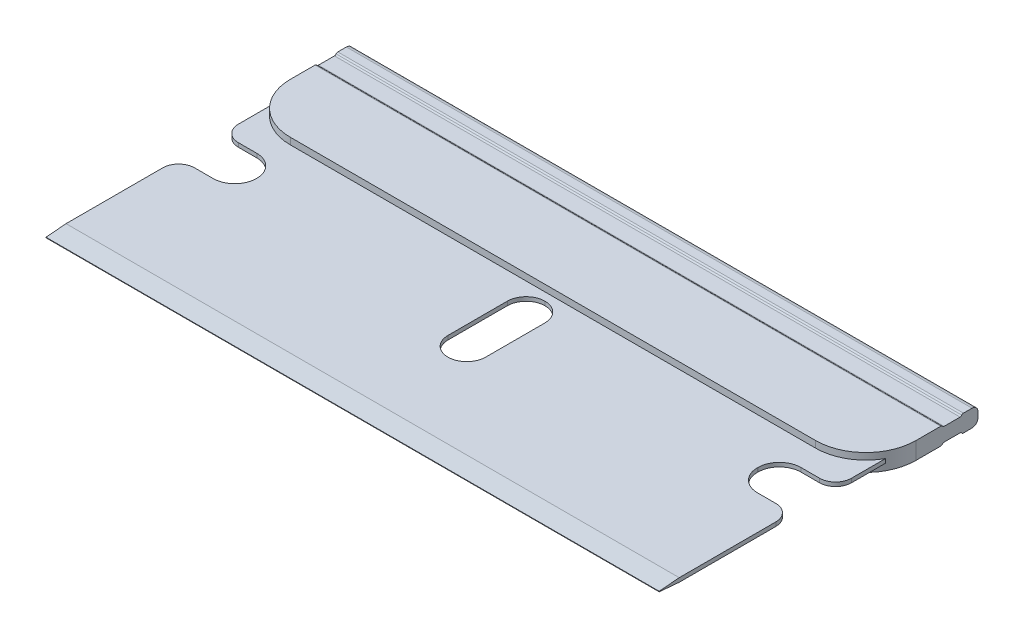
from build123d import *

# Parameters (mm, degrees)
SKETCH1_W           = 38.862
SKETCH1_H           = 19.812
BOSS_EXTRUDE1_DEPTH = 0.254
CHAMFER1_SIZE       = 1.27
CHAMFER1_SIZE2      = 0.111110603
CHAMFER2_SIZE       = 1.27
CHAMFER2_SIZE2      = 0.111110603
SKETCH2_W           = 38.862
SKETCH2_H           = 7.112
BOSS_EXTRUDE2_DEPTH = 1.0922
MOVE_FACE1_BY       = 0.3937
MOVE_FACE1_2_BY     = 0.3937
FILLET1_R           = 3.175
FILLET2_R           = 0.381
SKETCH3_W           = 1.27
SKETCH3_H           = 0.642734604
CUT_EXTRUDE1_DEPTH  = 46.780069848
FILLET3_R           = 0.127
FILLET4_R           = 0.127
CUT_EXTRUDE2_DEPTH  = 87.18132095
FILLET5_R           = 1.3716
FILLET6_R           = 1.016
SKETCH5_W           = 2.3876
SKETCH5_H           = 6.1468
CUT_EXTRUDE3_DEPTH  = 87.18132095
FILLET7_R           = 1.1938


# Some blends are built 0.0001 mm under size
with BuildPart() as part:
    # Sketch1 → Boss-Extrude1 (new body)
    with BuildSketch(Plane(origin=(0, 0, 0), x_dir=(1, 0, 0), z_dir=(0, 1, 0))):
        with Locations((-63.262484365, -12.969463084)):
            Rectangle(SKETCH1_W, SKETCH1_H)
    extrude(amount=BOSS_EXTRUDE1_DEPTH)

    # Chamfer1
    chamfer1_edges = [part.edges().sort_by_distance(p)[0] for p in [
        (-63.262484365, 0.254, 22.875463084),
    ]]
    chamfer1_side = [part.faces().sort_by_distance(p)[0] for p in [
        (-63.262484365, 0.254, 12.969463084),
    ]]
    chamfer(chamfer1_edges, length=CHAMFER1_SIZE, length2=CHAMFER1_SIZE2, reference=chamfer1_side[0])

    # Chamfer2
    chamfer2_edges = [part.edges().sort_by_distance(p)[0] for p in [
        (-63.262484365, 0, 22.875463084),
    ]]
    chamfer2_side = [part.faces().sort_by_distance(p)[0] for p in [
        (-63.262484365, 0, 12.969463084),
    ]]
    chamfer(chamfer2_edges, length=CHAMFER2_SIZE, length2=CHAMFER2_SIZE2, reference=chamfer2_side[0])


with BuildPart() as body_2:
    # Sketch2 → Boss-Extrude2 (new body)
    with BuildSketch(Plane(origin=(0, 0.254, 0), x_dir=(-1, 0, 0), z_dir=(0, 1, 0))):
        with Locations((63.262484365, 6.619463084)):
            Rectangle(SKETCH2_W, SKETCH2_H)
    extrude(amount=BOSS_EXTRUDE2_DEPTH)


with BuildPart() as body_2_1:
    # Body-Move/Copy1: moved
    add(body_2.part.moved(Location((0, -0.6731, 0))))

    # Move Face1: a face moved outward by 0.3937
    extrude(body_2_1.faces().sort_by_distance((-82.693484365, 0.127, 6.619463084))[0], amount=MOVE_FACE1_BY, dir=(-1, 0, 0))

    # Move Face1 2: a face moved outward by 0.3937
    extrude(body_2_1.faces().sort_by_distance((-43.831484365, 0.127, 6.619463084))[0], amount=MOVE_FACE1_2_BY, dir=(1, 0, 0))

    # Fillet1
    fillet1_edges = [body_2_1.edges().sort_by_distance(p)[0] for p in [
        (-43.437784365, 0.127, 10.175463084),
        (-83.087184365, 0.127, 10.175463084),
    ]]
    fillet(fillet1_edges, radius=FILLET1_R)


with BuildPart() as part_1:
    add(part.part)

    # Combine1: union body 2
    add(body_2_1.part)

    # Fillet2
    fillet2_edges = [part_1.edges().sort_by_distance(p)[0] for p in [
        (-63.262484365, -0.4191, 3.063463084),
        (-63.262484365, 0.6731, 3.063463084),
    ]]
    fillet(fillet2_edges, radius=FILLET2_R)

    # Sketch3 → Cut-Extrude1 (cut, through all)
    with BuildSketch(Plane(origin=(-43.437784365, 0, 0), x_dir=(0, 0, -1), z_dir=(1, 0, 0))):
        with Locations((-4.706856109, -0.628874986)):
            Rectangle(SKETCH3_W, SKETCH3_H)
        with Locations((-4.706856109, 0.882874986)):
            Rectangle(SKETCH3_W, SKETCH3_H)
    extrude(amount=-CUT_EXTRUDE1_DEPTH, mode=Mode.SUBTRACT)

    # Fillet3
    # the kernel refuses this fillet: 0.127 mm, written as the material it adds along each edge
    with BuildSketch(Plane(origin=(-43.437784365, -0.307507684, 5.341856109), x_dir=(0, 0, -1), z_dir=(-1, 0, 0))) as fillet3_piece_1_section:
        with BuildLine():
            CenterArc((FILLET3_R, FILLET3_R), FILLET3_R, 180, 90)
            Line((0, FILLET3_R), (0, 0))
            Line((0, 0), (FILLET3_R, 0))
        make_face()
    fillet3_piece_1 = extrude(amount=39.6494, mode=Mode.PRIVATE)
    fillet3_piece_1 = split(fillet3_piece_1, bisect_by=Plane(origin=(-63.262484365, -0.4191, 5.312781513), z_dir=(0, 1, 0)), keep=Keep.TOP, mode=Mode.PRIVATE)
    add(fillet3_piece_1)
    with BuildSketch(Plane(origin=(-43.437784365, -0.307507684, 4.071856109), x_dir=(0, -1, 0), z_dir=(-1, 0, 0))) as fillet3_piece_2_section:
        with BuildLine():
            CenterArc((FILLET3_R, FILLET3_R), FILLET3_R, 180, 90)
            Line((0, FILLET3_R), (0, 0))
            Line((0, 0), (FILLET3_R, 0))
        make_face()
    fillet3_piece_2 = extrude(amount=39.6494, mode=Mode.PRIVATE)
    fillet3_piece_2 = split(fillet3_piece_2, bisect_by=Plane(origin=(-63.262484365, -0.4191, 4.100930704), z_dir=(0, 1, 0)), keep=Keep.TOP, mode=Mode.PRIVATE)
    add(fillet3_piece_2)
    with BuildSketch(Plane(origin=(-43.437784365, 0.561507684, 5.341856109), x_dir=(0, 1, 0), z_dir=(-1, 0, 0))) as fillet3_piece_3_section:
        with BuildLine():
            CenterArc((FILLET3_R, FILLET3_R), FILLET3_R, 180, 90)
            Line((0, FILLET3_R), (0, 0))
            Line((0, 0), (FILLET3_R, 0))
        make_face()
    fillet3_piece_3 = extrude(amount=39.6494, mode=Mode.PRIVATE)
    fillet3_piece_3 = split(fillet3_piece_3, bisect_by=Plane(origin=(-63.262484365, 0.6731, 5.312781513), z_dir=(0, -1, 0)), keep=Keep.TOP, mode=Mode.PRIVATE)
    add(fillet3_piece_3)
    with BuildSketch(Plane(origin=(-43.437784365, 0.561507684, 4.071856109), x_dir=(0, 0, 1), z_dir=(-1, 0, 0))) as fillet3_piece_4_section:
        with BuildLine():
            CenterArc((FILLET3_R, FILLET3_R), FILLET3_R, 180, 90)
            Line((0, FILLET3_R), (0, 0))
            Line((0, 0), (FILLET3_R, 0))
        make_face()
    fillet3_piece_4 = extrude(amount=39.6494, mode=Mode.PRIVATE)
    fillet3_piece_4 = split(fillet3_piece_4, bisect_by=Plane(origin=(-63.262484365, 0.6731, 4.100930704), z_dir=(0, -1, 0)), keep=Keep.TOP, mode=Mode.PRIVATE)
    add(fillet3_piece_4)

    # Fillet4
    fillet4_edges = [part_1.edges().sort_by_distance(p)[0] for p in [
        (-63.262484365, -0.4191, 5.340918011),
        (-63.262484365, -0.4191, 4.072794206),
        (-63.262484365, 0.6731, 5.340918011),
        (-63.262484365, 0.6731, 4.072794206),
    ]]
    fillet(fillet4_edges, radius=FILLET4_R)

    # Sketch4 → Cut-Extrude2 (cut, through all)
    with BuildSketch(Plane(origin=(0, 0.254, 0), x_dir=(-1, 0, 0), z_dir=(0, 1, 0))):
        Polygon((82.693484365, 11.699463084), (79.137484365, 11.699463084), (79.137484365, 14.468063084), (84.344362943, 14.468063084), (84.344362943, 11.699463084), align=None)
        Polygon((47.387484365, 14.468063084), (42.180605788, 14.468063084), (42.180605788, 11.699463084), (43.831484365, 11.699463084), (47.387484365, 11.699463084), align=None)
    extrude(amount=-CUT_EXTRUDE2_DEPTH, mode=Mode.SUBTRACT)

    # Fillet5
    fillet5_edges = [part_1.edges().sort_by_distance(p)[0] for p in [
        (-79.137484365, 0.127, 11.699463084),
        (-79.137484365, 0.127, 14.468063084),
        (-47.387484365, 0.127, 14.468063084),
        (-47.387484365, 0.127, 11.699463084),
    ]]
    fillet(fillet5_edges, radius=FILLET5_R)

    # Fillet6
    fillet6_edges = [part_1.edges().sort_by_distance(p)[0] for p in [
        (-82.693484365, 0.127, 11.699463084),
        (-82.693484365, 0.127, 14.468063084),
        (-43.831484365, 0.127, 11.699463084),
        (-43.831484365, 0.127, 14.468063084),
    ]]
    fillet(fillet6_edges, radius=FILLET6_R)

    # Sketch5 → Cut-Extrude3 (cut, through all)
    with BuildSketch(Plane(origin=(0, 0.254, 0), x_dir=(1, 0, 0), z_dir=(0, 1, 0))):
        with Locations((-63.262484365, -13.756863084)):
            Rectangle(SKETCH5_W, SKETCH5_H)
    extrude(amount=-CUT_EXTRUDE3_DEPTH, mode=Mode.SUBTRACT)

    # Fillet7
    fillet7_edges = [part_1.edges().sort_by_distance(p)[0] for p in [
        (-64.456284365, 0.127, 16.830263084),
        (-62.068684365, 0.127, 16.830263084),
        (-62.068684365, 0.127, 10.683463084),
        (-64.456284365, 0.127, 10.683463084),
    ]]
    fillet(fillet7_edges, radius=FILLET7_R - 0.0001)  # a hair under: the kernel refuses the full size


solid = part_1.part
